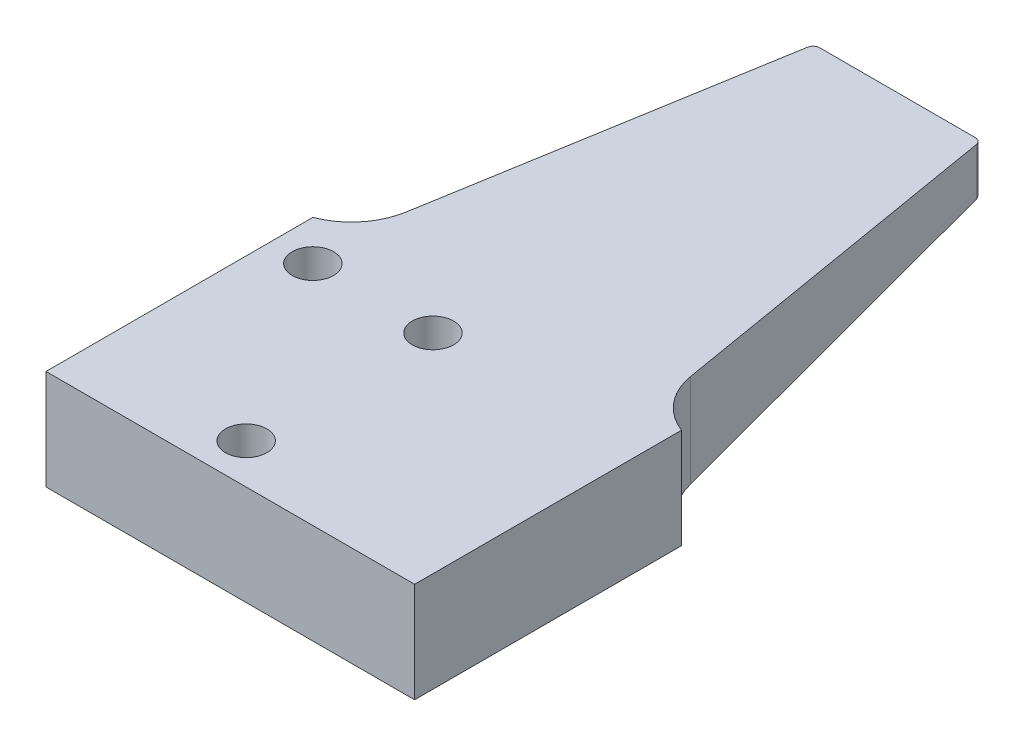
from build123d import *

# Parameters (mm, degrees)
SKETCH1_W           = 55.25
SKETCH1_H           = 100
SKETCH1_R           = 1.6
BOSS_EXTRUDE1_DEPTH = 15
SKETCH2_R           = 3.1
CUT_EXTRUDE1_DEPTH  = 7.5
CUT_EXTRUDE3_REACH  = 117.228
CUT_EXTRUDE2_REACH  = 117.228
FILLET3_R           = 10
FILLET4_R           = 1


with BuildPart() as part:
    # Sketch1 → Boss-Extrude1 (new body)
    with BuildSketch(Plane(origin=(0, 0, 0), x_dir=(1, 0, 0), z_dir=(0, 1, 0))):
        with Locations((27.625, 50)):
            Rectangle(SKETCH1_W, SKETCH1_H)
        with Locations(Location((24, 6, 0), (0, 0, 270))):
            Circle(SKETCH1_R, mode=Mode.SUBTRACT)
        with Locations(Location((6, 34, 0), (0, 0, 270))):
            Circle(SKETCH1_R, mode=Mode.SUBTRACT)
        with Locations(Location((24, 34, 0), (0, 0, 270))):
            Circle(SKETCH1_R, mode=Mode.SUBTRACT)
    extrude(amount=BOSS_EXTRUDE1_DEPTH)

    # Sketch2 → Cut-Extrude1 (cut)
    with BuildSketch(Plane(origin=(0, 15, 0), x_dir=(1, 0, 0), z_dir=(0, 1, 0))):
        with Locations(Location((24, 34, 0), (0, 0, 270))):
            Circle(SKETCH2_R)
        with Locations(Location((24, 6, 0), (0, 0, 270))):
            Circle(SKETCH2_R)
        with Locations(Location((6, 34, 0), (0, 0, 270))):
            Circle(SKETCH2_R)
    extrude(amount=-CUT_EXTRUDE1_DEPTH, mode=Mode.SUBTRACT)

    # Sketch5 → Cut-Extrude3 (cut, up to next)
    with BuildSketch(Plane(origin=(55.25, 0, 0), x_dir=(0, 0, -1), z_dir=(1, 0, 0)), mode=Mode.PRIVATE) as cut_extrude3_sk1:
        Polygon((40, 0), (100, 8), (100, 0), align=None)
    cut_extrude3_tool1 = extrude(cut_extrude3_sk1.sketch, amount=-CUT_EXTRUDE3_REACH, mode=Mode.PRIVATE) & part.part
    add(cut_extrude3_tool1.solids().sort_by_distance((55.25, 2.666667, -80))[0], mode=Mode.SUBTRACT)

    # Sketch3 → Cut-Extrude2 (cut, up to next)
    with BuildSketch(Plane(origin=(0, 15, 0), x_dir=(1, 0, 0), z_dir=(0, 1, 0)), mode=Mode.PRIVATE) as cut_extrude2_sk1:
        Polygon((40.125, 100), (55.25, 100), (55.25, 40), (50.25, 40), align=None)
    cut_extrude2_tool1 = extrude(cut_extrude2_sk1.sketch, amount=-CUT_EXTRUDE2_REACH, mode=Mode.PRIVATE) & part.part
    # Sketch3 → Cut-Extrude2 (cut, up to next)
    with BuildSketch(Plane(origin=(0, 15, 0), x_dir=(1, 0, 0), z_dir=(0, 1, 0)), mode=Mode.PRIVATE) as cut_extrude2_sk2:
        Polygon((15.125, 100), (0, 100), (0, 40), (5, 40), align=None)
    cut_extrude2_tool2 = extrude(cut_extrude2_sk2.sketch, amount=-CUT_EXTRUDE2_REACH, mode=Mode.PRIVATE) & part.part
    add(cut_extrude2_tool1.solids().sort_by_distance((49.794255, 15, -75.031056))[0], mode=Mode.SUBTRACT)
    add(cut_extrude2_tool2.solids().sort_by_distance((5.455745, 15, -75.031056))[0], mode=Mode.SUBTRACT)

    # Fillet3
    # the kernel refuses this fillet: 10 mm, written as the material it adds along each edge
    with BuildSketch(Plane(origin=(5, 15, -40), x_dir=(-1, 0, 0), z_dir=(0, -1, 0))) as fillet3_piece_1_section:
        with BuildLine():
            CenterArc((8.564743476, 9.343051105), FILLET3_R, 189.578422919, 59.537746257)
            Line((-1.295844232, 7.679076929), (-1.493055986, 7.645797446))
            Line((-1.493055986, 7.645797446), (-0.197211754, -0.033279484))
            Line((-0.197211754, -0.033279484), (0, -0.2))
            ThreePointArc((0, -0.2), (2.5, -0.2), (4.92870513, -0.186861022))
            Line((4.92870513, -0.186861022), (5, 0))
        make_face()
    fillet3_piece_1 = extrude(amount=15, mode=Mode.PRIVATE)
    fillet3_piece_1 = split(fillet3_piece_1, bisect_by=Plane(origin=(4.040002964, 0.373004519, -42.797533893), z_dir=(0, 0.9912279006826347, 0.13216372009101796)), keep=Keep.TOP, mode=Mode.PRIVATE)
    add(fillet3_piece_1)
    with BuildSketch(Plane(origin=(50.25, 15, -40), x_dir=(1, 0, 0), z_dir=(0, -1, 0))) as fillet3_piece_2_section:
        with BuildLine():
            CenterArc((8.564743476, -9.343051105), FILLET3_R, 110.883830823, 59.537746257)
            Line((-1.295844232, -7.679076929), (-1.493055986, -7.645797446))
            Line((-1.493055986, -7.645797446), (-0.197211754, 0.033279484))
            Line((-0.197211754, 0.033279484), (0, 0.2))
            ThreePointArc((0, 0.2), (2.5, 0.2), (4.92870513, 0.186861022))
            Line((4.92870513, 0.186861022), (5, 0))
        make_face()
    fillet3_piece_2 = extrude(amount=15, mode=Mode.PRIVATE)
    fillet3_piece_2 = split(fillet3_piece_2, bisect_by=Plane(origin=(51.209997036, 0.373004519, -42.797533893), z_dir=(0, 0.9912279006826347, 0.13216372009101796)), keep=Keep.TOP, mode=Mode.PRIVATE)
    add(fillet3_piece_2)

    # Fillet4
    fillet4_edges = [part.edges().sort_by_distance(p)[0] for p in [
        (27.625, 8, -100),
        (15.125, 11.5, -100),
        (40.125, 11.5, -100),
    ]]
    fillet(fillet4_edges, radius=FILLET4_R)


solid = part.part
